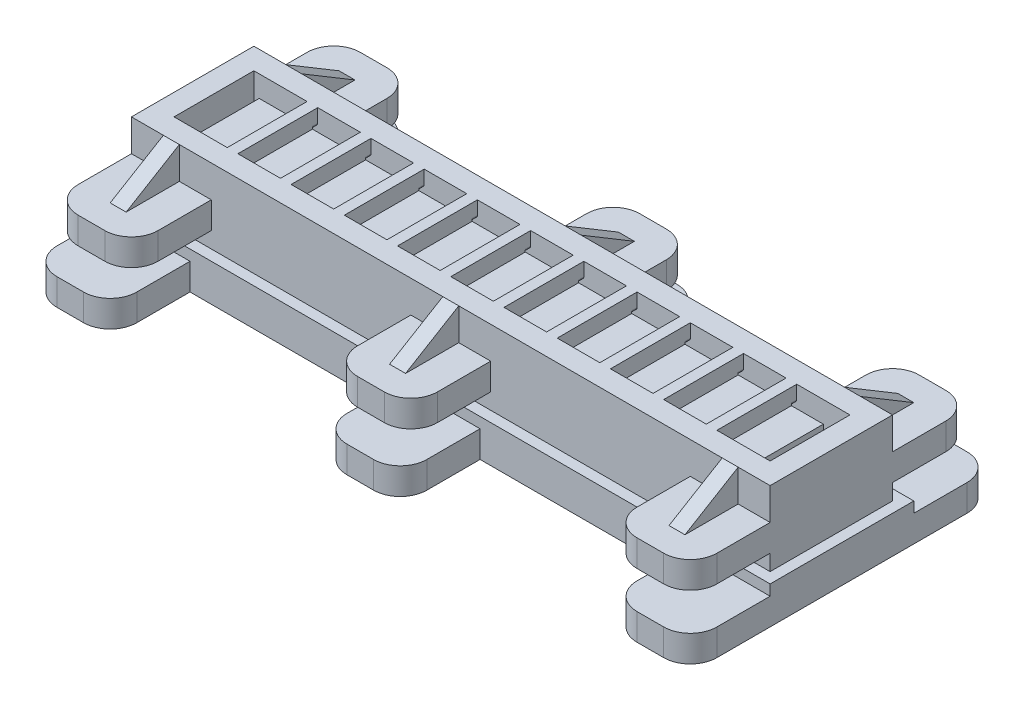
from build123d import *
from OCP.BRepFilletAPI import BRepFilletAPI_MakeChamfer

# Parameters (mm, degrees)
SKETCH1_W                       = 8
SKETCH1_H                       = 15
FIRST_CHAMBER_BLOCK_DEPTH       = 15
SKETCH2_W                       = 6
SKETCH2_H                       = 11
FIRST_CHAMBER_CAVITY_DEPTH      = 13
SKETCH3_W                       = 15
SKETCH3_H                       = 3
CHAMBER_SPACER_DEPTH            = 2
PATTERN_CHAMBERS_COUNT          = 11
PATTERN_CHAMBERS_PITCH          = 10
SKETCH4_W                       = 15
SKETCH4_H                       = 12
THICKEN_END_1_DEPTH             = 2
SKETCH5_W                       = 15
SKETCH5_H                       = 15
THICKEN_END_2_DEPTH             = 2
SKETCH6_W                       = 94
SKETCH6_H                       = 2
CENTRAL_AIR_CHANNEL_DEPTH       = 2
SKETCH7_W                       = 108
SKETCH7_H                       = 13
SKETCH7_W_2                     = 106
SKETCH7_H_2                     = 11
BONDING_RIDGE_DEPTH             = 2
SKETCH9_W                       = 2
SKETCH9_H                       = 2.5
BONDING_BUMPS_DEPTH             = 2
PATTERN_BONDING_BUMPS_COUNT     = 10
PATTERN_BONDING_BUMPS_PITCH     = 10
AUFSATZ_LINEAR_AUSTRAGEN3_REACH = 106.183
SCHNITT_LINEAR_AUSTRAGEN2_DEPTH = 113.026782512
LINEARES_MUSTER8_COUNT          = 10
LINEARES_MUSTER8_PITCH          = 10
SKETCH10_W                      = 120
SKETCH10_H                      = 23
ENCASING_BLOCK_DEPTH            = 21
SPLIT_START                     = -6
SPLIT_MOLD_OUTLINE_W            = 120
SPLIT_MOLD_OUTLINE_H            = 23
SPLIT_MOLD_DEPTH                = 6
SPLIT_MOLD_2_OUTLINE_W          = 6
SPLIT_MOLD_2_OUTLINE_H          = 11
SPLIT_MOLD_2_DEPTH              = 13
SPLIT_MOLD_3_OUTLINE_W          = 4
SPLIT_MOLD_3_OUTLINE_H          = 2
SPLIT_MOLD_3_DEPTH              = 2
SPLIT_START_2                   = 2
SPLIT_MOLD_4_DEPTH              = 11
SPLIT_START_3                   = -4
SPLIT_MOLD_5_DEPTH              = 23
SPLIT_MOLD_6_OUTLINE_W          = 108
SPLIT_MOLD_6_OUTLINE_H          = 2
SPLIT_MOLD_6_DEPTH              = 5
SPLIT_START_4                   = 14
SPLIT_MOLD_7_OUTLINE_W          = 108
SPLIT_MOLD_7_OUTLINE_H          = 2
SPLIT_MOLD_7_DEPTH              = 5
SPLIT_START_5                   = 6.5
SPLIT_MOLD_8_DEPTH              = 2
SPLIT_START_6                   = 5.5
SPLIT_MOLD_9_OUTLINE_W          = 2
SPLIT_MOLD_9_OUTLINE_H          = 2
SPLIT_MOLD_9_DEPTH              = 4
SPLIT_MOLD_10_OUTLINE_W         = 2
SPLIT_MOLD_10_OUTLINE_H         = 2
SPLIT_MOLD_10_DEPTH             = 1
SPLIT_START_7                   = 12
SPLIT_MOLD_11_OUTLINE_W         = 2
SPLIT_MOLD_11_OUTLINE_H         = 2
SPLIT_MOLD_11_DEPTH             = 1
SKETCH11_W                      = 15
SKETCH11_H                      = 5
GRIP_TAB_1_DEPTH                = 15
VERRUNDUNG1_R                   = 5
SKETCH13_W                      = 124
SKETCH13_H                      = 27
SKETCH13_W_2                    = 120
SKETCH13_H_2                    = 23
BASE_MOLD_LIP_DEPTH             = 7
SKETCH14_W                      = 15
SKETCH14_H                      = 5
BASE_GRIP_TABS_1_AND_2_DEPTH    = 15
SKETCH16_W                      = 15
SKETCH16_H                      = 5
BASE_GRIP_TABS_3_AND_4_DEPTH    = 15
FILLET_BASE_GRIP_TABS_R         = 5
SKIZZE1_W                       = 3
SKIZZE1_H                       = 6
AUFSATZ_LINEAR_AUSTRAGEN1_DEPTH = 10
FASE1_SIZE                      = 10
FASE1_SIZE_2                    = 6
FASE2_SIZE                      = 10
FASE2_SIZE_2                    = 6


# Read off the part's stored shape, not the designer's step: split mold
with BuildPart() as part:
    # Sketch1 → first chamber block (new body)
    with BuildSketch(Plane.XY):
        with Locations((4, 7.5)):
            Rectangle(SKETCH1_W, SKETCH1_H)
    extrude(amount=FIRST_CHAMBER_BLOCK_DEPTH)

    # Sketch2 → first chamber cavity (cut)
    with BuildSketch(Plane.XZ):
        with Locations((4, 7.5)):
            Rectangle(SKETCH2_W, SKETCH2_H)
    extrude(amount=-FIRST_CHAMBER_CAVITY_DEPTH, mode=Mode.SUBTRACT)

    # Sketch3 → chamber spacer (add)
    with BuildSketch(Plane(origin=(8, 0, 0), x_dir=(0, 0, -1), z_dir=(1, 0, 0))):
        with Locations((-7.5, 1.5)):
            Rectangle(SKETCH3_W, SKETCH3_H)
    extrude(amount=CHAMBER_SPACER_DEPTH)


with BuildPart() as pattern_chambers_1:
    # pattern chambers: pattern copy
    add(part.part.moved(Location(Vector(1, 0, 0) * (1 * PATTERN_CHAMBERS_PITCH))))


with BuildPart() as pattern_chambers_2:
    # pattern chambers: pattern copy
    add(part.part.moved(Location(Vector(1, 0, 0) * (2 * PATTERN_CHAMBERS_PITCH))))


with BuildPart() as pattern_chambers_3:
    # pattern chambers: pattern copy
    add(part.part.moved(Location(Vector(1, 0, 0) * (3 * PATTERN_CHAMBERS_PITCH))))


with BuildPart() as pattern_chambers_4:
    # pattern chambers: pattern copy
    add(part.part.moved(Location(Vector(1, 0, 0) * (4 * PATTERN_CHAMBERS_PITCH))))


with BuildPart() as pattern_chambers_5:
    # pattern chambers: pattern copy
    add(part.part.moved(Location(Vector(1, 0, 0) * (5 * PATTERN_CHAMBERS_PITCH))))


with BuildPart() as pattern_chambers_6:
    # pattern chambers: pattern copy
    add(part.part.moved(Location(Vector(1, 0, 0) * (6 * PATTERN_CHAMBERS_PITCH))))


with BuildPart() as pattern_chambers_7:
    # pattern chambers: pattern copy
    add(part.part.moved(Location(Vector(1, 0, 0) * (7 * PATTERN_CHAMBERS_PITCH))))


with BuildPart() as pattern_chambers_8:
    # pattern chambers: pattern copy
    add(part.part.moved(Location(Vector(1, 0, 0) * (8 * PATTERN_CHAMBERS_PITCH))))


with BuildPart() as pattern_chambers_9:
    # pattern chambers: pattern copy
    add(part.part.moved(Location(Vector(1, 0, 0) * (9 * PATTERN_CHAMBERS_PITCH))))


with BuildPart() as pattern_chambers_10:
    # pattern chambers: pattern copy
    add(part.part.moved(Location(Vector(1, 0, 0) * (10 * PATTERN_CHAMBERS_PITCH))))

    # combine into 1 solid body: union pattern chambers_9, pattern chambers_8, pattern chambers_7, pattern chambers_6, pattern chambers_5, pattern chambers_4, pattern chambers_3, pattern chambers_2, pattern chambers_1, part
    add(pattern_chambers_9.part)
    add(pattern_chambers_8.part)
    add(pattern_chambers_7.part)
    add(pattern_chambers_6.part)
    add(pattern_chambers_5.part)
    add(pattern_chambers_4.part)
    add(pattern_chambers_3.part)
    add(pattern_chambers_2.part)
    add(pattern_chambers_1.part)
    add(part.part)

    # Sketch4 → thicken end 1 (add)
    with BuildSketch(Plane(origin=(108, 0, 0), x_dir=(0, 0, -1), z_dir=(1, 0, 0))):
        with Locations((-7.5, 9)):
            Rectangle(SKETCH4_W, SKETCH4_H)
    extrude(amount=THICKEN_END_1_DEPTH)

    # Sketch5 → thicken end 2 (add)
    with BuildSketch(Plane.ZY):
        with Locations((7.5, 7.5)):
            Rectangle(SKETCH5_W, SKETCH5_H)
    extrude(amount=THICKEN_END_2_DEPTH)

    # Sketch6 → central air channel (cut)
    with BuildSketch(Plane.XZ):
        with Locations((54, 7.5)):
            Rectangle(SKETCH6_W, SKETCH6_H)
    extrude(amount=-CENTRAL_AIR_CHANNEL_DEPTH, mode=Mode.SUBTRACT)

    # Sketch7 → bonding ridge (add)
    with BuildSketch(Plane.XZ):
        with Locations((54, 7.5)):
            Rectangle(SKETCH7_W, SKETCH7_H)
        with Locations((54, 7.5)):
            Rectangle(SKETCH7_W_2, SKETCH7_H_2, mode=Mode.SUBTRACT)
    extrude(amount=BONDING_RIDGE_DEPTH)

    # Sketch9 → bonding bumps (add)
    with BuildSketch(Plane.XZ):
        with Locations((9, 10.75)):
            Rectangle(SKETCH9_W, SKETCH9_H)
        with Locations((9, 4.25)):
            Rectangle(SKETCH9_W, SKETCH9_H)
    bonding_bumps = extrude(amount=BONDING_BUMPS_DEPTH)

    # pattern bonding bumps: bonding bumps ×10
    with Locations(*[(i * PATTERN_BONDING_BUMPS_PITCH, 0, 0) for i in range(1, PATTERN_BONDING_BUMPS_COUNT)]):
        add(bonding_bumps)

    # Skizze3 → Aufsatz-Linear austragen3 (add, up to next)
    with BuildSketch(Plane(origin=(8, 0, 0), x_dir=(0, 0, -1), z_dir=(1, 0, 0)), mode=Mode.PRIVATE) as aufsatz_linear_austragen3_sk1:
        Polygon((-15, 3), (-13.5, 3), (-14, 12.5), (-15, 12.5), align=None)
    aufsatz_linear_austragen3_tool1 = extrude(aufsatz_linear_austragen3_sk1.sketch, amount=AUFSATZ_LINEAR_AUSTRAGEN3_REACH, mode=Mode.PRIVATE) - pattern_chambers_10.part
    # Skizze3 → Aufsatz-Linear austragen3 (add, up to next)
    with BuildSketch(Plane(origin=(8, 0, 0), x_dir=(0, 0, -1), z_dir=(1, 0, 0)), mode=Mode.PRIVATE) as aufsatz_linear_austragen3_sk2:
        Polygon((0, 12.5), (0, 3), (-1.5, 3), (-1, 12.5), align=None)
    aufsatz_linear_austragen3_tool2 = extrude(aufsatz_linear_austragen3_sk2.sketch, amount=AUFSATZ_LINEAR_AUSTRAGEN3_REACH, mode=Mode.PRIVATE) - pattern_chambers_10.part
    aufsatz_linear_austragen3_1 = aufsatz_linear_austragen3_tool1.solids().sort_by_distance((8, 7.433333, 14.366667))[0]
    add(aufsatz_linear_austragen3_1)
    aufsatz_linear_austragen3_2 = aufsatz_linear_austragen3_tool2.solids().sort_by_distance((8, 7.433333, 0.633333))[0]
    add(aufsatz_linear_austragen3_2)
    aufsatz_linear_austragen3 = aufsatz_linear_austragen3_1 + aufsatz_linear_austragen3_2  # Aufsatz-Linear austragen3 as one shape, for the pattern or mirror that repeats it

    # Skizze5 → Schnitt-Linear austragen2 (cut, through all)
    with BuildSketch(Plane(origin=(0, 0, 0), x_dir=(-1, 0, 0), z_dir=(0, 0, -1))):
        with BuildLine():
            Line((-10, 12.5), (-8, 12.5))
            Line((-8, 12.5), (-8, 12.45))
            ThreePointArc((-8, 12.45), (-8.131801948, 12.131801948), (-8.45, 12))
            Line((-8.45, 12), (-9.55, 12))
            ThreePointArc((-9.55, 12), (-9.868198052, 12.131801948), (-10, 12.45))
            Line((-10, 12.45), (-10, 12.5))
        make_face()
    schnitt_linear_austragen2 = extrude(amount=-SCHNITT_LINEAR_AUSTRAGEN2_DEPTH, mode=Mode.SUBTRACT)

    # Lineares Muster8: Aufsatz-Linear austragen3, Schnitt-Linear austragen2 ×10
    with Locations(*[(i * LINEARES_MUSTER8_PITCH, 0, 0) for i in range(1, LINEARES_MUSTER8_COUNT)]):
        add(aufsatz_linear_austragen3)
        add(schnitt_linear_austragen2, mode=Mode.SUBTRACT)


with BuildPart() as body_2:
    # Sketch10 → encasing block (new body)
    with BuildSketch(Plane(origin=(0, 15, 0), x_dir=(1, 0, 0), z_dir=(0, 1, 0))):
        with Locations((54, -7.5)):
            Rectangle(SKETCH10_W, SKETCH10_H)
    extrude(amount=-ENCASING_BLOCK_DEPTH)

    # subtract actuator: cut pattern chambers_10
    add(pattern_chambers_10.part, mode=Mode.SUBTRACT)

    # split mold outline → split mold (cut)
    with BuildSketch(Plane(origin=(0, 0, 0), x_dir=(1, 0, 0), z_dir=(0, 1, 0)).offset(SPLIT_START)):
        with Locations((54, -7.5)):
            Rectangle(SPLIT_MOLD_OUTLINE_W, SPLIT_MOLD_OUTLINE_H)
    extrude(amount=SPLIT_MOLD_DEPTH, mode=Mode.SUBTRACT)

    # split mold 2 outline → split mold 2 (cut)
    with BuildSketch(Plane(origin=(0, 0, 0), x_dir=(1, 0, 0), z_dir=(0, 1, 0))):
        with Locations((14, -7.5)):
            Rectangle(SPLIT_MOLD_2_OUTLINE_W, SPLIT_MOLD_2_OUTLINE_H)
        with Locations((4, -7.5)):
            Rectangle(SPLIT_MOLD_2_OUTLINE_W, SPLIT_MOLD_2_OUTLINE_H)
        with Locations((24, -7.5)):
            Rectangle(SPLIT_MOLD_2_OUTLINE_W, SPLIT_MOLD_2_OUTLINE_H)
        with Locations((34, -7.5)):
            Rectangle(SPLIT_MOLD_2_OUTLINE_W, SPLIT_MOLD_2_OUTLINE_H)
        with Locations((44, -7.5)):
            Rectangle(SPLIT_MOLD_2_OUTLINE_W, SPLIT_MOLD_2_OUTLINE_H)
        with Locations((54, -7.5)):
            Rectangle(SPLIT_MOLD_2_OUTLINE_W, SPLIT_MOLD_2_OUTLINE_H)
        with Locations((64, -7.5)):
            Rectangle(SPLIT_MOLD_2_OUTLINE_W, SPLIT_MOLD_2_OUTLINE_H)
        with Locations((74, -7.5)):
            Rectangle(SPLIT_MOLD_2_OUTLINE_W, SPLIT_MOLD_2_OUTLINE_H)
        with Locations((84, -7.5)):
            Rectangle(SPLIT_MOLD_2_OUTLINE_W, SPLIT_MOLD_2_OUTLINE_H)
        with Locations((94, -7.5)):
            Rectangle(SPLIT_MOLD_2_OUTLINE_W, SPLIT_MOLD_2_OUTLINE_H)
        with Locations((104, -7.5)):
            Rectangle(SPLIT_MOLD_2_OUTLINE_W, SPLIT_MOLD_2_OUTLINE_H)
    extrude(amount=SPLIT_MOLD_2_DEPTH, mode=Mode.SUBTRACT)

    # split mold 3 outline → split mold 3 (cut)
    with BuildSketch(Plane(origin=(0, 0, 0), x_dir=(1, 0, 0), z_dir=(0, 1, 0))):
        with Locations((9, -7.5)):
            Rectangle(SPLIT_MOLD_3_OUTLINE_W, SPLIT_MOLD_3_OUTLINE_H)
        with Locations((19, -7.5)):
            Rectangle(SPLIT_MOLD_3_OUTLINE_W, SPLIT_MOLD_3_OUTLINE_H)
        with Locations((29, -7.5)):
            Rectangle(SPLIT_MOLD_3_OUTLINE_W, SPLIT_MOLD_3_OUTLINE_H)
        with Locations((39, -7.5)):
            Rectangle(SPLIT_MOLD_3_OUTLINE_W, SPLIT_MOLD_3_OUTLINE_H)
        with Locations((49, -7.5)):
            Rectangle(SPLIT_MOLD_3_OUTLINE_W, SPLIT_MOLD_3_OUTLINE_H)
        with Locations((59, -7.5)):
            Rectangle(SPLIT_MOLD_3_OUTLINE_W, SPLIT_MOLD_3_OUTLINE_H)
        with Locations((69, -7.5)):
            Rectangle(SPLIT_MOLD_3_OUTLINE_W, SPLIT_MOLD_3_OUTLINE_H)
        with Locations((79, -7.5)):
            Rectangle(SPLIT_MOLD_3_OUTLINE_W, SPLIT_MOLD_3_OUTLINE_H)
        with Locations((89, -7.5)):
            Rectangle(SPLIT_MOLD_3_OUTLINE_W, SPLIT_MOLD_3_OUTLINE_H)
        with Locations((99, -7.5)):
            Rectangle(SPLIT_MOLD_3_OUTLINE_W, SPLIT_MOLD_3_OUTLINE_H)
    extrude(amount=SPLIT_MOLD_3_DEPTH, mode=Mode.SUBTRACT)

    # Sketch11 → grip tab 1 (add)
    with BuildSketch(Plane.XY.offset(19)):
        with Locations((1.5, 6.5)):
            Rectangle(SKETCH11_W, SKETCH11_H)
        with Locations((54, 6.5)):
            Rectangle(SKETCH11_W, SKETCH11_H)
        with Locations((106.5, 6.5)):
            Rectangle(SKETCH11_W, SKETCH11_H)
    grip_tab_1 = extrude(amount=GRIP_TAB_1_DEPTH)

    # Spiegeln1: grip tab 1 across plane
    add(grip_tab_1.mirror(Plane.XY.offset(7.5)))

    # Verrundung1
    verrundung1_edges = [body_2.edges().sort_by_distance(p)[0] for p in [
        (-6, 6.5, -19),
        (9, 6.5, -19),
        (46.5, 6.5, -19),
        (61.5, 6.5, -19),
        (99, 6.5, -19),
        (114, 6.5, -19),
        (114, 6.5, 34),
        (99, 6.5, 34),
        (61.5, 6.5, 34),
        (46.5, 6.5, 34),
        (9, 6.5, 34),
        (-6, 6.5, 34),
    ]]
    fillet(verrundung1_edges, radius=VERRUNDUNG1_R)

    # Skizze1 → Aufsatz-Linear austragen1 (add)
    with BuildSketch(Plane.XY.offset(19)):
        with Locations((1.5, 12)):
            Rectangle(SKIZZE1_W, SKIZZE1_H)
        with Locations((54, 12)):
            Rectangle(SKIZZE1_W, SKIZZE1_H)
        with Locations((106.5, 12)):
            Rectangle(SKIZZE1_W, SKIZZE1_H)
    aufsatz_linear_austragen1 = extrude(amount=AUFSATZ_LINEAR_AUSTRAGEN1_DEPTH)

    # Spiegeln2: Aufsatz-Linear austragen1 across plane
    add(aufsatz_linear_austragen1.mirror(Plane.XY.offset(7.5)))

    # Fase1
    fase1_edges_1 = [body_2.edges().sort_by_distance(p)[0] for p in [
        (1.5, 15, 29),
    ]]
    fase1_side_1 = [body_2.faces().sort_by_distance(p)[0] for p in [
        (1.5, 15, 28.88),
    ]]
    fase1_edges_2 = [body_2.edges().sort_by_distance(p)[0] for p in [
        (106.5, 15, 29),
    ]]
    fase1_side_2 = [body_2.faces().sort_by_distance(p)[0] for p in [
        (106.5, 15, 28.88),
    ]]
    fase1_edges_3 = [body_2.edges().sort_by_distance(p)[0] for p in [
        (54, 15, 29),
    ]]
    fase1_side_3 = [body_2.faces().sort_by_distance(p)[0] for p in [
        (54, 15, 28.88),
    ]]
    fase1 = BRepFilletAPI_MakeChamfer(body_2.part.solid().wrapped)
    for e in fase1_edges_1:
        fase1.Add(FASE1_SIZE - 0.0001, FASE1_SIZE_2 - 0.0001, e.wrapped, fase1_side_1[0].wrapped)
    for e in fase1_edges_2:
        fase1.Add(FASE1_SIZE - 0.0001, FASE1_SIZE_2 - 0.0001, e.wrapped, fase1_side_2[0].wrapped)
    for e in fase1_edges_3:
        fase1.Add(FASE1_SIZE - 0.0001, FASE1_SIZE_2 - 0.0001, e.wrapped, fase1_side_3[0].wrapped)
    add(Compound.cast(fase1.Shape()), mode=Mode.REPLACE)  # a hair under: the kernel refuses the full size

    # Fase2
    fase2_edges_1 = [body_2.edges().sort_by_distance(p)[0] for p in [
        (106.5, 15, -14),
    ]]
    fase2_side_1 = [body_2.faces().sort_by_distance(p)[0] for p in [
        (106.5, 15, -13.88),
    ]]
    fase2_edges_2 = [body_2.edges().sort_by_distance(p)[0] for p in [
        (54, 15, -14),
    ]]
    fase2_side_2 = [body_2.faces().sort_by_distance(p)[0] for p in [
        (54, 15, -13.88),
    ]]
    fase2_edges_3 = [body_2.edges().sort_by_distance(p)[0] for p in [
        (1.5, 15, -14),
    ]]
    fase2_side_3 = [body_2.faces().sort_by_distance(p)[0] for p in [
        (1.5, 15, -13.88),
    ]]
    fase2 = BRepFilletAPI_MakeChamfer(body_2.part.solid().wrapped)
    for e in fase2_edges_1:
        fase2.Add(FASE2_SIZE - 0.0001, FASE2_SIZE_2 - 0.0001, e.wrapped, fase2_side_1[0].wrapped)
    for e in fase2_edges_2:
        fase2.Add(FASE2_SIZE - 0.0001, FASE2_SIZE_2 - 0.0001, e.wrapped, fase2_side_2[0].wrapped)
    for e in fase2_edges_3:
        fase2.Add(FASE2_SIZE - 0.0001, FASE2_SIZE_2 - 0.0001, e.wrapped, fase2_side_3[0].wrapped)
    add(Compound.cast(fase2.Shape()), mode=Mode.REPLACE)  # a hair under: the kernel refuses the full size


with BuildPart() as body_2_2:
    # split mold 4 outline → split mold 4 (new body)
    with BuildSketch(Plane.XY.offset(SPLIT_START_2)):
        Polygon((7, 0), (7, 13), (1, 13), (1, -2), (0, -2), (0, 0), (-6, 0), (-6, -6), (114, -6), (114, 0), (108, 0), (108, -2), (107, -2), (107, 13), (101, 13), (101, 0), (100, 0), (100, -2), (98, -2), (98, 0), (97, 0), (97, 13), (91, 13), (91, 0), (90, 0), (90, -2), (88, -2), (88, 0), (87, 0), (87, 13), (81, 13), (81, 0), (80, 0), (80, -2), (78, -2), (78, 0), (77, 0), (77, 13), (71, 13), (71, 0), (70, 0), (70, -2), (68, -2), (68, 0), (67, 0), (67, 13), (61, 13), (61, 0), (60, 0), (60, -2), (58, -2), (58, 0), (57, 0), (57, 13), (51, 13), (51, 0), (50, 0), (50, -2), (48, -2), (48, 0), (47, 0), (47, 13), (41, 13), (41, 0), (40, 0), (40, -2), (38, -2), (38, 0), (37, 0), (37, 13), (31, 13), (31, 0), (30, 0), (30, -2), (28, -2), (28, 0), (27, 0), (27, 13), (21, 13), (21, 0), (20, 0), (20, -2), (18, -2), (18, 0), (17, 0), (17, 13), (11, 13), (11, 0), (10, 0), (10, -2), (8, -2), (8, 0), align=None)
    extrude(amount=SPLIT_MOLD_4_DEPTH)

    # split mold 5 outline → split mold 5 (add)
    with BuildSketch(Plane.XY.offset(SPLIT_START_3)):
        Polygon((108, -2), (0, -2), (0, 0), (-6, 0), (-6, -6), (114, -6), (114, 0), (108, 0), align=None)
    extrude(amount=SPLIT_MOLD_5_DEPTH)

    # split mold 6 outline → split mold 6 (add)
    with BuildSketch(Plane.XY.offset(SPLIT_START_3)):
        with Locations((54, -1)):
            Rectangle(SPLIT_MOLD_6_OUTLINE_W, SPLIT_MOLD_6_OUTLINE_H)
    extrude(amount=SPLIT_MOLD_6_DEPTH)

    # split mold 7 outline → split mold 7 (add)
    with BuildSketch(Plane.XY.offset(SPLIT_START_4)):
        with Locations((54, -1)):
            Rectangle(SPLIT_MOLD_7_OUTLINE_W, SPLIT_MOLD_7_OUTLINE_H)
    extrude(amount=SPLIT_MOLD_7_DEPTH)

    # split mold 8 outline → split mold 8 (add)
    with BuildSketch(Plane.XY.offset(SPLIT_START_5)):
        Polygon((11, 2), (7, 2), (7, 0), (8, 0), (8, -2), (10, -2), (10, 0), (11, 0), align=None)
        Polygon((17, 2), (17, 0), (18, 0), (18, -2), (20, -2), (20, 0), (21, 0), (21, 2), align=None)
        Polygon((27, 2), (27, 0), (28, 0), (28, -2), (30, -2), (30, 0), (31, 0), (31, 2), align=None)
        Polygon((38, 0), (38, -2), (40, -2), (40, 0), (41, 0), (41, 2), (37, 2), (37, 0), align=None)
        Polygon((100, 0), (101, 0), (101, 2), (97, 2), (97, 0), (98, 0), (98, -2), (100, -2), align=None)
        Polygon((48, 0), (48, -2), (50, -2), (50, 0), (51, 0), (51, 2), (47, 2), (47, 0), align=None)
        Polygon((58, 0), (58, -2), (60, -2), (60, 0), (61, 0), (61, 2), (57, 2), (57, 0), align=None)
        Polygon((88, -2), (90, -2), (90, 0), (91, 0), (91, 2), (87, 2), (87, 0), (88, 0), align=None)
        Polygon((68, 0), (68, -2), (70, -2), (70, 0), (71, 0), (71, 2), (67, 2), (67, 0), align=None)
        Polygon((78, -2), (80, -2), (80, 0), (81, 0), (81, 2), (77, 2), (77, 0), (78, 0), align=None)
    extrude(amount=SPLIT_MOLD_8_DEPTH)

    # split mold 9 outline → split mold 9 (add)
    with BuildSketch(Plane.XY.offset(SPLIT_START_6)):
        with Locations((9, -1)):
            Rectangle(SPLIT_MOLD_9_OUTLINE_W, SPLIT_MOLD_9_OUTLINE_H)
        with Locations((19, -1)):
            Rectangle(SPLIT_MOLD_9_OUTLINE_W, SPLIT_MOLD_9_OUTLINE_H)
        with Locations((29, -1)):
            Rectangle(SPLIT_MOLD_9_OUTLINE_W, SPLIT_MOLD_9_OUTLINE_H)
        with Locations((39, -1)):
            Rectangle(SPLIT_MOLD_9_OUTLINE_W, SPLIT_MOLD_9_OUTLINE_H)
        with Locations((49, -1)):
            Rectangle(SPLIT_MOLD_9_OUTLINE_W, SPLIT_MOLD_9_OUTLINE_H)
        with Locations((99, -1)):
            Rectangle(SPLIT_MOLD_9_OUTLINE_W, SPLIT_MOLD_9_OUTLINE_H)
        with Locations((59, -1)):
            Rectangle(SPLIT_MOLD_9_OUTLINE_W, SPLIT_MOLD_9_OUTLINE_H)
        with Locations((89, -1)):
            Rectangle(SPLIT_MOLD_9_OUTLINE_W, SPLIT_MOLD_9_OUTLINE_H)
        with Locations((69, -1)):
            Rectangle(SPLIT_MOLD_9_OUTLINE_W, SPLIT_MOLD_9_OUTLINE_H)
        with Locations((79, -1)):
            Rectangle(SPLIT_MOLD_9_OUTLINE_W, SPLIT_MOLD_9_OUTLINE_H)
    extrude(amount=SPLIT_MOLD_9_DEPTH)

    # split mold 10 outline → split mold 10 (add)
    with BuildSketch(Plane.XY.offset(SPLIT_START_2)):
        with Locations((9, -1)):
            Rectangle(SPLIT_MOLD_10_OUTLINE_W, SPLIT_MOLD_10_OUTLINE_H)
        with Locations((19, -1)):
            Rectangle(SPLIT_MOLD_10_OUTLINE_W, SPLIT_MOLD_10_OUTLINE_H)
        with Locations((29, -1)):
            Rectangle(SPLIT_MOLD_10_OUTLINE_W, SPLIT_MOLD_10_OUTLINE_H)
        with Locations((39, -1)):
            Rectangle(SPLIT_MOLD_10_OUTLINE_W, SPLIT_MOLD_10_OUTLINE_H)
        with Locations((49, -1)):
            Rectangle(SPLIT_MOLD_10_OUTLINE_W, SPLIT_MOLD_10_OUTLINE_H)
        with Locations((99, -1)):
            Rectangle(SPLIT_MOLD_10_OUTLINE_W, SPLIT_MOLD_10_OUTLINE_H)
        with Locations((59, -1)):
            Rectangle(SPLIT_MOLD_10_OUTLINE_W, SPLIT_MOLD_10_OUTLINE_H)
        with Locations((89, -1)):
            Rectangle(SPLIT_MOLD_10_OUTLINE_W, SPLIT_MOLD_10_OUTLINE_H)
        with Locations((69, -1)):
            Rectangle(SPLIT_MOLD_10_OUTLINE_W, SPLIT_MOLD_10_OUTLINE_H)
        with Locations((79, -1)):
            Rectangle(SPLIT_MOLD_10_OUTLINE_W, SPLIT_MOLD_10_OUTLINE_H)
    extrude(amount=SPLIT_MOLD_10_DEPTH)

    # split mold 11 outline → split mold 11 (add)
    with BuildSketch(Plane.XY.offset(SPLIT_START_7)):
        with Locations((9, -1)):
            Rectangle(SPLIT_MOLD_11_OUTLINE_W, SPLIT_MOLD_11_OUTLINE_H)
        with Locations((19, -1)):
            Rectangle(SPLIT_MOLD_11_OUTLINE_W, SPLIT_MOLD_11_OUTLINE_H)
        with Locations((29, -1)):
            Rectangle(SPLIT_MOLD_11_OUTLINE_W, SPLIT_MOLD_11_OUTLINE_H)
        with Locations((39, -1)):
            Rectangle(SPLIT_MOLD_11_OUTLINE_W, SPLIT_MOLD_11_OUTLINE_H)
        with Locations((49, -1)):
            Rectangle(SPLIT_MOLD_11_OUTLINE_W, SPLIT_MOLD_11_OUTLINE_H)
        with Locations((99, -1)):
            Rectangle(SPLIT_MOLD_11_OUTLINE_W, SPLIT_MOLD_11_OUTLINE_H)
        with Locations((59, -1)):
            Rectangle(SPLIT_MOLD_11_OUTLINE_W, SPLIT_MOLD_11_OUTLINE_H)
        with Locations((89, -1)):
            Rectangle(SPLIT_MOLD_11_OUTLINE_W, SPLIT_MOLD_11_OUTLINE_H)
        with Locations((69, -1)):
            Rectangle(SPLIT_MOLD_11_OUTLINE_W, SPLIT_MOLD_11_OUTLINE_H)
        with Locations((79, -1)):
            Rectangle(SPLIT_MOLD_11_OUTLINE_W, SPLIT_MOLD_11_OUTLINE_H)
    extrude(amount=SPLIT_MOLD_11_DEPTH)

    # Sketch13 → base mold lip (add)
    with BuildSketch(Plane.XZ.offset(6)):
        with Locations((54, 7.5)):
            Rectangle(SKETCH13_W, SKETCH13_H)
        with Locations((54, 7.5)):
            Rectangle(SKETCH13_W_2, SKETCH13_H_2, mode=Mode.SUBTRACT)
    extrude(amount=-BASE_MOLD_LIP_DEPTH)

    # Sketch14 → base grip tabs 1 and 2 (add)
    with BuildSketch(Plane.XY.offset(21)):
        with Locations((-0.5, -3.5)):
            Rectangle(SKETCH14_W, SKETCH14_H)
        with Locations((108.5, -3.5)):
            Rectangle(SKETCH14_W, SKETCH14_H)
        with Locations((54, -3.5)):
            Rectangle(SKETCH14_W, SKETCH14_H)
    extrude(amount=BASE_GRIP_TABS_1_AND_2_DEPTH)

    # Sketch16 → base grip tabs 3 and 4 (add)
    with BuildSketch(Plane(origin=(0, 0, -6), x_dir=(-1, 0, 0), z_dir=(0, 0, -1))):
        with Locations((-108.5, -3.5)):
            Rectangle(SKETCH16_W, SKETCH16_H)
        with Locations((0.5, -3.5)):
            Rectangle(SKETCH16_W, SKETCH16_H)
        with Locations((-54, -3.5)):
            Rectangle(SKETCH16_W, SKETCH16_H)
    extrude(amount=BASE_GRIP_TABS_3_AND_4_DEPTH)

    # fillet base grip tabs
    fillet_base_grip_tabs_edges = [body_2_2.edges().sort_by_distance(p)[0] for p in [
        (116, -3.5, -21),
        (101, -3.5, -21),
        (7, -3.5, -21),
        (-8, -3.5, -21),
        (116, -3.5, 36),
        (101, -3.5, 36),
        (7, -3.5, 36),
        (-8, -3.5, 36),
        (46.5, -3.5, 36),
        (61.5, -3.5, 36),
        (46.5, -3.5, -21),
        (61.5, -3.5, -21),
    ]]
    fillet(fillet_base_grip_tabs_edges, radius=FILLET_BASE_GRIP_TABS_R)


solid = Compound([body_2.part, body_2_2.part])
